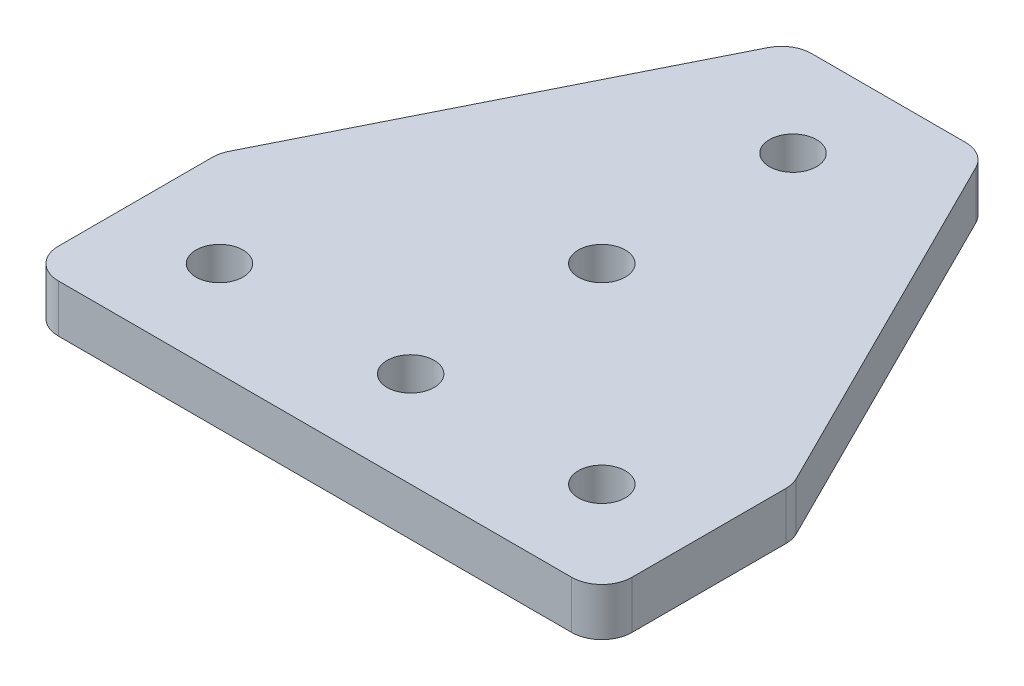
from build123d import *

# Parameters (mm, degrees)
SKETCH1_R           = 3.125
BOSS_EXTRUDE1_DEPTH = 6.35
FILLET1_R           = 4


with BuildPart() as part:
    # Sketch1 → Boss-Extrude1 (new body)
    with BuildSketch(Plane(origin=(0, 0, 0), x_dir=(1, 0, 0), z_dir=(0, 1, 0))):
        Polygon((0, -12.7), (-38.1, -12.7), (-38.1, 12.7), (-12.7, 63.5), (12.7, 63.5), (38.1, 12.7), (38.1, -12.7), align=None)
        with Locations((0, 50.8)):
            Circle(SKETCH1_R, mode=Mode.SUBTRACT)
        with Locations((0, 25.4)):
            Circle(SKETCH1_R, mode=Mode.SUBTRACT)
        with Locations((25.4, 0)):
            Circle(SKETCH1_R, mode=Mode.SUBTRACT)
        Circle(SKETCH1_R, mode=Mode.SUBTRACT)
        with Locations((-25.4, 0)):
            Circle(SKETCH1_R, mode=Mode.SUBTRACT)
    extrude(amount=BOSS_EXTRUDE1_DEPTH)

    # Fillet1
    fillet1_edges = [part.edges().sort_by_distance(p)[0] for p in [
        (12.7, 3.175, -63.5),
        (-12.7, 3.175, -63.5),
        (-38.1, 3.175, -12.7),
        (-38.1, 3.175, 12.7),
        (38.1, 3.175, 12.7),
        (38.1, 3.175, -12.7),
    ]]
    fillet(fillet1_edges, radius=FILLET1_R)


solid = part.part
